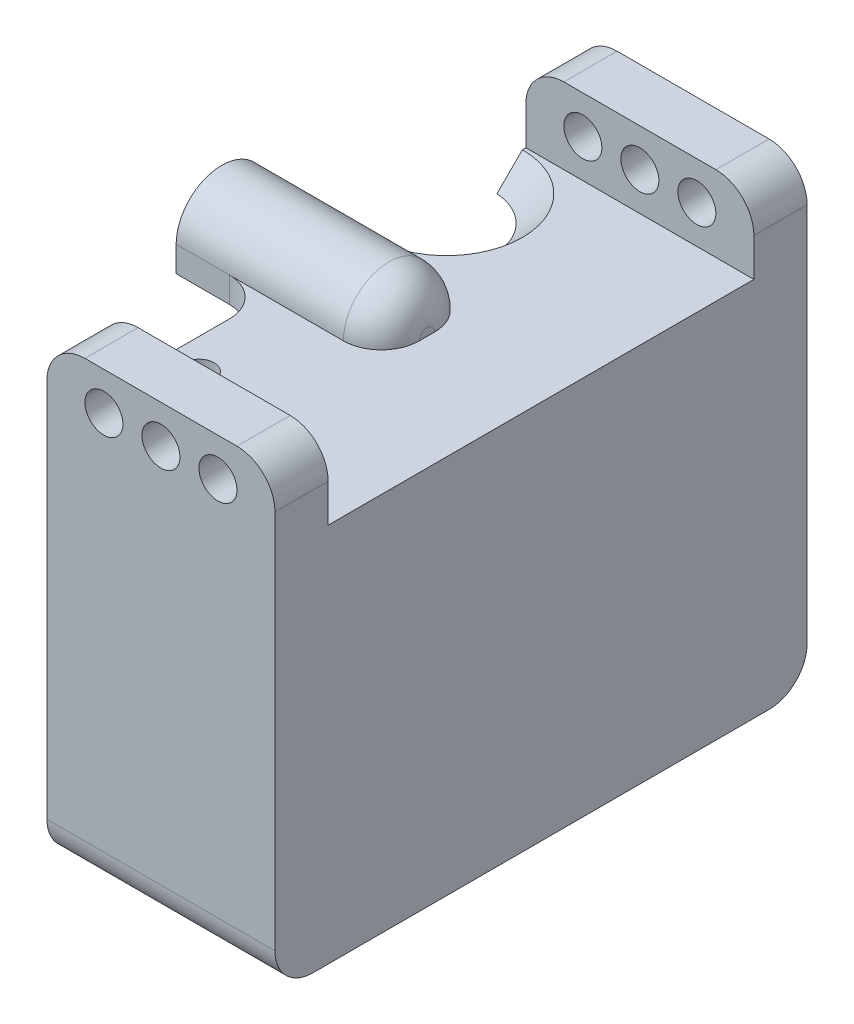
from build123d import *

# Parameters (mm, degrees)
SKETCH1_W                = 70
SKETCH1_H                = 50
BOSS_EXTRUDE1_DEPTH      = 30
SKETCH2_W                = 61.1
SKETCH2_H                = 43.3
CUT_EXTRUDE1_DEPTH       = 28
CUT_EXTRUDE1_DRAFT       = -2
SKETCH3_W                = 7
SKETCH3_H                = 13.35
HANG_TABS_DEPTH          = 30
BOSS_EXTRUDE3_DEPTH      = 12
BOSS_EXTRUDE3_DEPTH_BACK = 15
SKETCH5_R                = 1.5
CUT_EXTRUDE2_DEPTH       = 15
SKETCH6_R                = 5
CUT_EXTRUDE3_DEPTH       = 58.879184514
CUT_EXTRUDE4_DEPTH       = 58.879184514
CUT_EXTRUDE5_START       = -28
SKETCH8_R                = 2.5
CUT_EXTRUDE5_DEPTH       = 30.879184514
CUT_EXTRUDE6_START       = 28
SKETCH8_2_R              = 2.5
CUT_EXTRUDE6_DEPTH       = 30.879184514
FILLET2_R                = 5
FILLET3_R                = 5
CHAMFER1_SIZE            = 5
FILLET4_R                = 5
BOSS_EXTRUDE4_START      = -17.5
SKETCH9_W                = 15
SKETCH9_H                = 5
BOSS_EXTRUDE4_DEPTH      = 10.5
FILLET5_R                = 5
FILLET6_R                = 1


with BuildPart() as part:
    # Sketch1 → Boss-Extrude1 (new body)
    with BuildSketch(Plane(origin=(0, 0, 0), x_dir=(0, 0, -1), z_dir=(1, 0, 0))):
        Rectangle(SKETCH1_W, SKETCH1_H)
    extrude(amount=BOSS_EXTRUDE1_DEPTH)


with BuildPart() as cut_extrude1_tool:
    # Sketch2 → Cut-Extrude1 (with draft: the straight prism first)
    with BuildSketch(Plane.ZY):
        Rectangle(SKETCH2_W, SKETCH2_H)
    extrude(amount=-CUT_EXTRUDE1_DEPTH)
    # Cut-Extrude1: the draft: its side faces are tilted about the plane it starts from
    cut_extrude1_sides = [cut_extrude1_tool.faces().sort_by_distance(p)[0] for p in [
        (14, -21.65, 0),
        (14, 0, 30.55),
        (14, 21.65, 0),
        (14, 0, -30.55),
    ]]
    draft(cut_extrude1_sides, Plane.ZY, CUT_EXTRUDE1_DRAFT)


with BuildPart() as part_1:
    add(part.part)

    # Cut-Extrude1: cut by cut_extrude1_tool
    add(cut_extrude1_tool.part, mode=Mode.SUBTRACT)

    # Sketch3 → Hang tabs (add)
    with BuildSketch(Plane(origin=(0, 0, 0), x_dir=(0, 0, -1), z_dir=(1, 0, 0))):
        with Locations((-31.5, 28.325)):
            Rectangle(SKETCH3_W, SKETCH3_H)
        with Locations((31.5, 28.325)):
            Rectangle(SKETCH3_W, SKETCH3_H)
    extrude(amount=HANG_TABS_DEPTH)

    # Sketch4 → Boss-Extrude3 (add, two sides: drawn at the far end of the back side and taken through both)
    with BuildSketch(Plane.ZY.offset(-BOSS_EXTRUDE3_DEPTH_BACK)):
        with BuildLine():
            Line((-6, 25), (-6, 21.65))
            Line((-6, 21.65), (6, 21.65))
            Line((6, 21.65), (6, 25))
            ThreePointArc((6, 25), (0, 31), (-6, 25))
        make_face()
        with BuildLine():
            Line((-6, -21.65), (6, -21.65))
            Line((6, -21.65), (6, -25))
            ThreePointArc((6, -25), (0, -31), (-6, -25))
            Line((-6, -25), (-6, -21.65))
        make_face()
    extrude(amount=BOSS_EXTRUDE3_DEPTH + BOSS_EXTRUDE3_DEPTH_BACK)

    # Sketch5 → Cut-Extrude2 (cut)
    with BuildSketch(Plane.ZY.offset(12)):
        with Locations((0, 25)):
            Circle(SKETCH5_R)
        with Locations((0, -25)):
            Circle(SKETCH5_R)
    extrude(amount=-CUT_EXTRUDE2_DEPTH, mode=Mode.SUBTRACT)

    # Sketch6 → Cut-Extrude3 (cut, through all)
    with BuildSketch(Plane(origin=(0, 0, 0), x_dir=(1, 0, 0), z_dir=(0, 1, 0))):
        with Locations((0, 17.55)):
            Circle(SKETCH6_R)
    extrude(amount=CUT_EXTRUDE3_DEPTH, mode=Mode.SUBTRACT)

    # Sketch7 → Cut-Extrude4 (cut, through all)
    with BuildSketch(Plane(origin=(0, 0, 0), x_dir=(1, 0, 0), z_dir=(0, 1, 0))):
        with BuildLine():
            Line((6, -19), (6, -23))
            ThreePointArc((6, -23), (4, -25), (2, -23))
            Line((2, -23), (2, -19))
            ThreePointArc((2, -19), (4, -17), (6, -19))
        make_face()
    extrude(amount=CUT_EXTRUDE4_DEPTH, mode=Mode.SUBTRACT)

    # Sketch8 → Cut-Extrude5 (cut, through all)
    with BuildSketch(Plane.XY.offset(CUT_EXTRUDE5_START)):
        with Locations((15, 30)):
            Circle(SKETCH8_R)
        with Locations((22.5, 30)):
            Circle(SKETCH8_R)
        with Locations((7.5, 30)):
            Circle(SKETCH8_R)
    extrude(amount=-CUT_EXTRUDE5_DEPTH, mode=Mode.SUBTRACT)

    # Sketch8<2> → Cut-Extrude6 (cut, through all)
    with BuildSketch(Plane.XY.offset(CUT_EXTRUDE6_START)):
        with Locations((15, 30)):
            Circle(SKETCH8_2_R)
        with Locations((22.5, 30)):
            Circle(SKETCH8_2_R)
        with Locations((7.5, 30)):
            Circle(SKETCH8_2_R)
    extrude(amount=CUT_EXTRUDE6_DEPTH, mode=Mode.SUBTRACT)

    # Fillet2
    fillet2_edges = [part_1.edges().sort_by_distance(p)[0] for p in [
        (30, 35, 31.5),
        (0, 35, 31.5),
        (30, 35, -31.5),
        (0, 35, -31.5),
    ]]
    fillet(fillet2_edges, radius=FILLET2_R)

    # Fillet3
    fillet3_edges = [part_1.edges().sort_by_distance(p)[0] for p in [
        (15, 31, 0),
        (15, -31, 0),
    ]]
    fillet(fillet3_edges, radius=FILLET3_R)

    # Chamfer1
    # the kernel refuses this chamfer: 5 mm, written as the material it takes off along each edge
    with BuildSketch(Plane(origin=(0, 25, -17.55), x_dir=(-0.9999950652018581, 0, -0.003141587485879425), z_dir=(-0.003141587485879425, 0, 0.9999950652018581))) as chamfer1_piece_1:
        Polygon((5 + CHAMFER1_SIZE, 0), (5, CHAMFER1_SIZE), (5, 0), align=None)
    revolve(axis=Axis((0, 25, -17.55), (0, -1, 0)), revolution_arc=359.64, mode=Mode.SUBTRACT)

    # Fillet4
    fillet4_edges = [part_1.edges().sort_by_distance(p)[0] for p in [
        (15, -25, -35),
        (15, -25, 35),
    ]]
    fillet(fillet4_edges, radius=FILLET4_R)

    # Sketch9 → Boss-Extrude4 (add)
    with BuildSketch(Plane.ZY.offset(BOSS_EXTRUDE4_START)):
        with Locations((0, 19.15)):
            Rectangle(SKETCH9_W, SKETCH9_H)
        with Locations((0, -19.15)):
            Rectangle(SKETCH9_W, SKETCH9_H)
    extrude(amount=-BOSS_EXTRUDE4_DEPTH)

    # Fillet5
    fillet5_edges = [part_1.edges().sort_by_distance(p)[0] for p in [
        (0, 23.325, 6),
        (0, -23.325, 6),
        (0, -23.325, -6),
    ]]
    fillet(fillet5_edges, radius=FILLET5_R)

    # Fillet6
    fillet6_edges = [part_1.edges().sort_by_distance(p)[0] for p in [
        (14, 21.161109227, 30.061109227),
        (14, -21.161109227, 30.061109227),
        (14, -21.161109227, -30.061109227),
        (14, 21.161109227, -30.061109227),
        (28, 0, 29.572218454),
        (28, -20.672218454, 18.536109227),
        (28, 0, -29.572218454),
        (28, 20.672218454, -18.536109227),
        (28, 20.672218454, 18.536109227),
        (28, -20.672218454, -18.536109227),
    ]]
    fillet(fillet6_edges, radius=FILLET6_R)


solid = part_1.part
